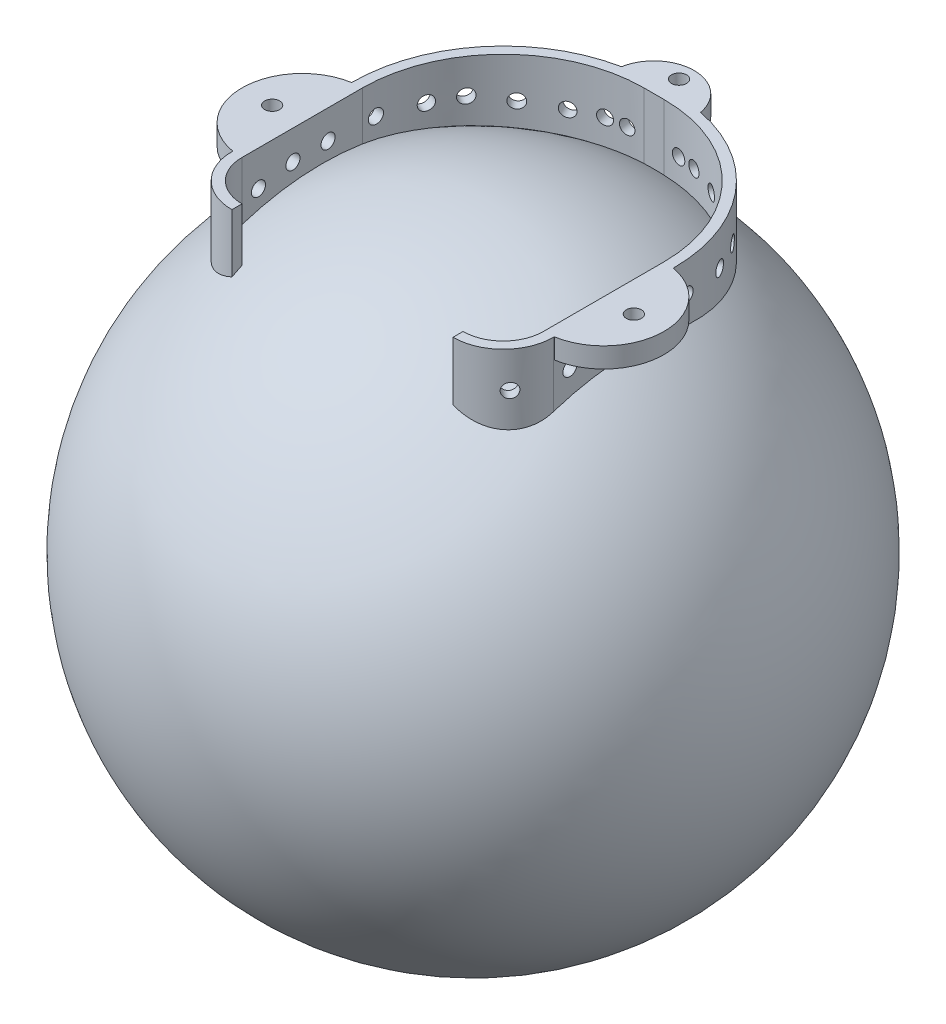
from build123d import *

# Parameters (mm, degrees)
EXTRUDE_THIN2_REACH                   = 39.581
EXTRUDE_THIN2_END_RADIUS              = 15
EXTRUDE_ANCHOR_EARS_DEPTH             = 1
SKETCH16_W                            = 0.375
SKETCH16_H                            = 3.291739257
TAP_DRILL_FOR_M1X0_25_TAP3_AT_2_COUNT = 2
TAP_DRILL_FOR_M1X0_25_TAP3_AT_2_PITCH = 18
TAP_DRILL_FOR_M1X0_25_TAP3_AT_3_COUNT = 2
TAP_DRILL_FOR_M1X0_25_TAP3_AT_3_PITCH = 14.407029534
CUT_EXTRUDE1_DEPTH                    = 0.5
F_0_7_START                           = -8.052623508
F_0_7_0_7_DIAMETER_HOLE1_OUTLINE_R    = 0.35
F_0_7_0_7_DIAMETER_HOLE1_DEPTH        = 0.508755669
F_0_7_START_2                         = -8.107157929
F_0_7_0_7_DIAMETER_HOLE1_2_OUTLINE_R  = 0.35
F_0_7_0_7_DIAMETER_HOLE1_2_DEPTH      = 0.508757306
F_0_7_START_3                         = -8.205448964
F_0_7_0_7_DIAMETER_HOLE1_3_OUTLINE_R  = 0.35
F_0_7_0_7_DIAMETER_HOLE1_3_DEPTH      = 0.50875567
F_0_7_START_4                         = -8.152085126
F_0_7_0_7_DIAMETER_HOLE1_4_OUTLINE_R  = 0.35
F_0_7_0_7_DIAMETER_HOLE1_4_DEPTH      = 0.50875567
F_0_7_START_5                         = -8
F_0_7_0_7_DIAMETER_HOLE1_5_OUTLINE_R  = 0.35
F_0_7_0_7_DIAMETER_HOLE1_5_DEPTH      = 0.5
F_0_7_START_6                         = -8.168887142
F_0_7_0_7_DIAMETER_HOLE1_6_OUTLINE_R  = 0.35
F_0_7_0_7_DIAMETER_HOLE1_6_DEPTH      = 0.50875567
F_0_7_START_7                         = -8.194791383
F_0_7_0_7_DIAMETER_HOLE1_7_OUTLINE_R  = 0.35
F_0_7_0_7_DIAMETER_HOLE1_7_DEPTH      = 0.508755669
F_0_7_START_8                         = -8.042856653
F_0_7_0_7_DIAMETER_HOLE1_8_OUTLINE_R  = 0.35
F_0_7_0_7_DIAMETER_HOLE1_8_DEPTH      = 0.508755669
F_0_7_START_9                         = -10.24159406
F_0_7_0_7_DIAMETER_HOLE1_9_OUTLINE_R  = 0.35
F_0_7_0_7_DIAMETER_HOLE1_9_DEPTH      = 0.530863293


# Read off the part's stored shape, not the designer's step: Ø0.7 (0.7) Diameter Hole1
with BuildPart() as part:
    # Sketch10 → Revolve1 (revolve)
    with BuildSketch(Plane(origin=(0, -15.25, 0), x_dir=(1, 0, 0), z_dir=(0, 1, 0))):
        with BuildLine():
            Line((0, -16.5), (0, 13.5))
            ThreePointArc((0, 13.5), (15, -1.5), (0, -16.5))
        make_face()
    revolve(axis=Axis((0, -15.25, 16.5), (0, 0, -1)))


with BuildPart() as body_2:
    # Extrude-Thin2: up to this sphere (the profile starts outside it)
    extrude_thin2_end = Location((0, -15.25, 1.5)) * Sphere(EXTRUDE_THIN2_END_RADIUS, mode=Mode.PRIVATE)
    # Sketch1 → Extrude-Thin2 (new, up to the surface)
    with BuildSketch(Plane(origin=(0, 0, 0), x_dir=(1, 0, 0), z_dir=(0, 1, 0)), mode=Mode.PRIVATE) as extrude_thin2_sk1:
        with BuildLine():
            Line((-8, -5.5), (-8, 0.5))
            ThreePointArc((-8, 0.5), (-5.803300859, 5.803300859), (-0.5, 8))
            Line((-0.5, 8), (0.5, 8))
            ThreePointArc((0.5, 8), (5.803300859, 5.803300859), (8, 0.5))
            Line((8, 0.5), (8, -5.5))
            ThreePointArc((8, -5.5), (7.267766953, -7.267766953), (5.5, -8))
            Line((5.5, -8), (-5.5, -8))
            ThreePointArc((-5.5, -8), (-7.267766953, -7.267766953), (-8, -5.5))
        make_face()
        with BuildLine():
            Line((-7.5, -5.5), (-7.5, 0.5))
            ThreePointArc((-7.5, 0.5), (-5.449747468, 5.449747468), (-0.5, 7.5))
            Line((-0.5, 7.5), (0.5, 7.5))
            ThreePointArc((0.5, 7.5), (5.449747468, 5.449747468), (7.5, 0.5))
            Line((7.5, 0.5), (7.5, -5.5))
            ThreePointArc((7.5, -5.5), (6.914213562, -6.914213562), (5.5, -7.5))
            Line((5.5, -7.5), (-5.5, -7.5))
            ThreePointArc((-5.5, -7.5), (-6.914213562, -6.914213562), (-7.5, -5.5))
        make_face(mode=Mode.SUBTRACT)
    extrude_thin2_tool1 = extrude(extrude_thin2_sk1.sketch, amount=-EXTRUDE_THIN2_REACH, mode=Mode.PRIVATE) - extrude_thin2_end
    add(extrude_thin2_tool1.solids().sort_by_distance((0, 0, 7.773726))[0])

    # Sketch1<13> → extrude-anchor-ears (add)
    with BuildSketch(Plane(origin=(0, 0, 0), x_dir=(1, 0, 0), z_dir=(0, 1, 0))):
        with BuildLine():
            ThreePointArc((7.5, 0.5), (10.5, -2.5), (7.5, -5.5))
            Line((7.5, -5.5), (7.5, 0.5))
        make_face()
        with BuildLine():
            Line((-7.5, 0.5), (-7.5, -5.5))
            ThreePointArc((-7.5, -5.5), (-10.5, -2.5), (-7.5, 0.5))
        make_face()
        with BuildLine():
            ThreePointArc((-1.993494757, 7.338821054), (-1.251083425, 7.459588615), (-0.5, 7.5))
            Line((-0.5, 7.5), (0.5, 7.5))
            ThreePointArc((0.5, 7.5), (1.251083425, 7.459588615), (1.993494757, 7.338821054))
            ThreePointArc((1.993494757, 7.338821054), (0, 9.5), (-1.993494757, 7.338821054))
        make_face()
    extrude(amount=-EXTRUDE_ANCHOR_EARS_DEPTH)

    # Sketch16 → Tap Drill for M1x0.25 Tap3 (revolve, cut)
    with BuildSketch(Plane(origin=(9, 0, 2.5), x_dir=(0, 0, 1), z_dir=(1, 0, 0))):
        with Locations((0.1875, 1.645869629)):
            Rectangle(SKETCH16_W, SKETCH16_H)
    tap_drill_for_m1x0_25_tap3 = revolve(axis=Axis((9, 6.35, 2.5), (0, -1, 0)), mode=Mode.SUBTRACT)

    # Tap Drill for M1x0.25 Tap3 at 2: Tap Drill for M1x0.25 Tap3 ×2
    with Locations(*[(-i * TAP_DRILL_FOR_M1X0_25_TAP3_AT_2_PITCH, 0, 0) for i in range(1, TAP_DRILL_FOR_M1X0_25_TAP3_AT_2_COUNT)]):
        add(tap_drill_for_m1x0_25_tap3, mode=Mode.SUBTRACT)

    # Tap Drill for M1x0.25 Tap3 at 3: Tap Drill for M1x0.25 Tap3 ×2
    with Locations(*[Vector(-0.6246950475544204, 0, -0.7808688094430335) * (i * TAP_DRILL_FOR_M1X0_25_TAP3_AT_3_PITCH) for i in range(1, TAP_DRILL_FOR_M1X0_25_TAP3_AT_3_COUNT)]):
        add(tap_drill_for_m1x0_25_tap3, mode=Mode.SUBTRACT)

    # Sketch19 → Cut-Extrude1 (cut)
    with BuildSketch(Plane.XY.offset(8)):
        with BuildLine():
            Line((5.5, -2.900910965), (5.5, 0))
            Line((5.5, 0), (-5.5, 0))
            Line((-5.5, 0), (-5.5, -2.900910965))
            ThreePointArc((-5.5, -2.900910965), (0, -1.731494165), (5.5, -2.900910965))
        make_face()
    extrude(amount=-CUT_EXTRUDE1_DEPTH, mode=Mode.SUBTRACT)

    # Ø0.7 (0.7) Diameter Hole1 outline → Ø0.7 (0.7) Diameter Hole1 (cut)
    with BuildSketch(Plane(origin=(0, 0, 0), x_dir=(0.9937666601370941, 0, -0.11148015608154302), z_dir=(0.11148015608154302, 0, 0.9937666601370941)).offset(F_0_7_START)):
        with Locations((-0.441143252, -2.060148298)):
            Circle(F_0_7_0_7_DIAMETER_HOLE1_OUTLINE_R)
    f_0_7_0_7_diameter_hole1 = extrude(amount=F_0_7_0_7_DIAMETER_HOLE1_DEPTH, mode=Mode.SUBTRACT)

    # 0.7 _0.7_ Diameter Hole1 2 outline → 0.7 _0.7_ Diameter Hole1 2 (cut)
    with BuildSketch(Plane(origin=(0, 0, 0), x_dir=(0.9695942668565711, 0, -0.24471811882014005), z_dir=(0.24471811882014005, 0, 0.9695942668565712)).offset(F_0_7_START_2)):
        with Locations((-0.362438074, -2.024413143)):
            Circle(F_0_7_0_7_DIAMETER_HOLE1_2_OUTLINE_R)
    f_0_7_0_7_diameter_hole1_2 = extrude(amount=F_0_7_0_7_DIAMETER_HOLE1_2_DEPTH, mode=Mode.SUBTRACT)

    # 0.7 _0.7_ Diameter Hole1 3 outline → 0.7 _0.7_ Diameter Hole1 3 (cut)
    with BuildSketch(Plane(origin=(0, 0, 0), x_dir=(0.7538420494439949, 0, -0.6570556783789921), z_dir=(0.657055678378992, 0, 0.753842049443995)).offset(F_0_7_START_3)):
        with Locations((-0.048393186, -2.00231467)):
            Circle(F_0_7_0_7_DIAMETER_HOLE1_3_OUTLINE_R)
    f_0_7_0_7_diameter_hole1_3 = extrude(amount=F_0_7_0_7_DIAMETER_HOLE1_3_DEPTH, mode=Mode.SUBTRACT)

    # 0.7 _0.7_ Diameter Hole1 4 outline → 0.7 _0.7_ Diameter Hole1 4 (cut)
    with BuildSketch(Plane(origin=(0, 0, 0), x_dir=(0, 1, 0), z_dir=(0.9255537063280848, 0, 0.3786163450015669)).offset(F_0_7_START_4)):
        with Locations((-1.716969327, -0.273468681)):
            Circle(F_0_7_0_7_DIAMETER_HOLE1_4_OUTLINE_R)
    f_0_7_0_7_diameter_hole1_4 = extrude(amount=F_0_7_0_7_DIAMETER_HOLE1_4_DEPTH, mode=Mode.SUBTRACT)

    # 0.7 _0.7_ Diameter Hole1 5 outline → 0.7 _0.7_ Diameter Hole1 5 (cut)
    with BuildSketch(Plane.YZ.offset(F_0_7_START_5)):
        with Locations((-1.755351193, 4.679921836)):
            Circle(F_0_7_0_7_DIAMETER_HOLE1_5_OUTLINE_R)
        with Locations((-1.435832157, 1.215665398)):
            Circle(F_0_7_0_7_DIAMETER_HOLE1_5_OUTLINE_R)
        with Locations((-1.463714729, 2.964592546)):
            Circle(F_0_7_0_7_DIAMETER_HOLE1_5_OUTLINE_R)
    f_0_7_0_7_diameter_hole1_5 = extrude(amount=F_0_7_0_7_DIAMETER_HOLE1_5_DEPTH, mode=Mode.SUBTRACT)

    # 0.7 _0.7_ Diameter Hole1 6 outline → 0.7 _0.7_ Diameter Hole1 6 (cut)
    with BuildSketch(Plane(origin=(0, 0, 0), x_dir=(0.8982124122509182, 0, -0.4395616708476601), z_dir=(0.4395616708476601, 0, 0.8982124122509182)).offset(F_0_7_START_6)):
        with Locations((-0.229325371, -2.117265978)):
            Circle(F_0_7_0_7_DIAMETER_HOLE1_6_OUTLINE_R)
    f_0_7_0_7_diameter_hole1_6 = extrude(amount=F_0_7_0_7_DIAMETER_HOLE1_6_DEPTH, mode=Mode.SUBTRACT)

    # 0.7 _0.7_ Diameter Hole1 7 outline → 0.7 _0.7_ Diameter Hole1 7 (cut)
    with BuildSketch(Plane(origin=(0, 0, 0), x_dir=(0.563394658762015, 0, -0.8261879074874144), z_dir=(0.8261879074874144, 0, 0.5633946587620153)).offset(F_0_7_START_7)):
        with Locations((0.131396624, -1.716167875)):
            Circle(F_0_7_0_7_DIAMETER_HOLE1_7_OUTLINE_R)
    f_0_7_0_7_diameter_hole1_7 = extrude(amount=F_0_7_0_7_DIAMETER_HOLE1_7_DEPTH, mode=Mode.SUBTRACT)

    # 0.7 _0.7_ Diameter Hole1 8 outline → 0.7 _0.7_ Diameter Hole1 8 (cut)
    with BuildSketch(Plane(origin=(0, 0, 0), x_dir=(0, 1, 0), z_dir=(0.995964446140709, 0, 0.0897486602887809)).offset(F_0_7_START_8)):
        with Locations((-1.526462117, -0.453107893)):
            Circle(F_0_7_0_7_DIAMETER_HOLE1_8_OUTLINE_R)
    f_0_7_0_7_diameter_hole1_8 = extrude(amount=F_0_7_0_7_DIAMETER_HOLE1_8_DEPTH, mode=Mode.SUBTRACT)

    # 0.7 _0.7_ Diameter Hole1 9 outline → 0.7 _0.7_ Diameter Hole1 9 (cut)
    with BuildSketch(Plane(origin=(0, 0, 0), x_dir=(0.6352836398747318, 0, 0.772278898395853), z_dir=(0.7722788983958528, 0, -0.635283639874732)).offset(F_0_7_START_9)):
        with Locations((0.753473922, 1.786723576)):
            Circle(F_0_7_0_7_DIAMETER_HOLE1_9_OUTLINE_R)
    f_0_7_0_7_diameter_hole1_9 = extrude(amount=F_0_7_0_7_DIAMETER_HOLE1_9_DEPTH, mode=Mode.SUBTRACT)

    # Mirror3: Ø0.7 (0.7) Diameter Hole1, 0.7 _0.7_ Diameter Hole1 2, 0.7 _0.7_ Diameter Hole1 3, 0.7 _0.7_ Diameter Hole1 4, 0.7 _0.7_ Diameter Hole1 5, 0.7 _0.7_ Diameter Hole1 6, 0.7 _0.7_ Diameter Hole1 7, 0.7 _0.7_ Diameter Hole1 8, 0.7 _0.7_ Diameter Hole1 9 across plane
    add(f_0_7_0_7_diameter_hole1.mirror(Plane(origin=(0, 0, 0), x_dir=(0, 0, 1), z_dir=(1, 0, 0))), mode=Mode.SUBTRACT)
    add(f_0_7_0_7_diameter_hole1_2.mirror(Plane(origin=(0, 0, 0), x_dir=(0, 0, 1), z_dir=(1, 0, 0))), mode=Mode.SUBTRACT)
    add(f_0_7_0_7_diameter_hole1_3.mirror(Plane(origin=(0, 0, 0), x_dir=(0, 0, 1), z_dir=(1, 0, 0))), mode=Mode.SUBTRACT)
    add(f_0_7_0_7_diameter_hole1_4.mirror(Plane(origin=(0, 0, 0), x_dir=(0, 0, 1), z_dir=(1, 0, 0))), mode=Mode.SUBTRACT)
    add(f_0_7_0_7_diameter_hole1_5.mirror(Plane(origin=(0, 0, 0), x_dir=(0, 0, 1), z_dir=(1, 0, 0))), mode=Mode.SUBTRACT)
    add(f_0_7_0_7_diameter_hole1_6.mirror(Plane(origin=(0, 0, 0), x_dir=(0, 0, 1), z_dir=(1, 0, 0))), mode=Mode.SUBTRACT)
    add(f_0_7_0_7_diameter_hole1_7.mirror(Plane(origin=(0, 0, 0), x_dir=(0, 0, 1), z_dir=(1, 0, 0))), mode=Mode.SUBTRACT)
    add(f_0_7_0_7_diameter_hole1_8.mirror(Plane(origin=(0, 0, 0), x_dir=(0, 0, 1), z_dir=(1, 0, 0))), mode=Mode.SUBTRACT)
    add(f_0_7_0_7_diameter_hole1_9.mirror(Plane(origin=(0, 0, 0), x_dir=(0, 0, 1), z_dir=(1, 0, 0))), mode=Mode.SUBTRACT)


solid = Compound([part.part, body_2.part])
